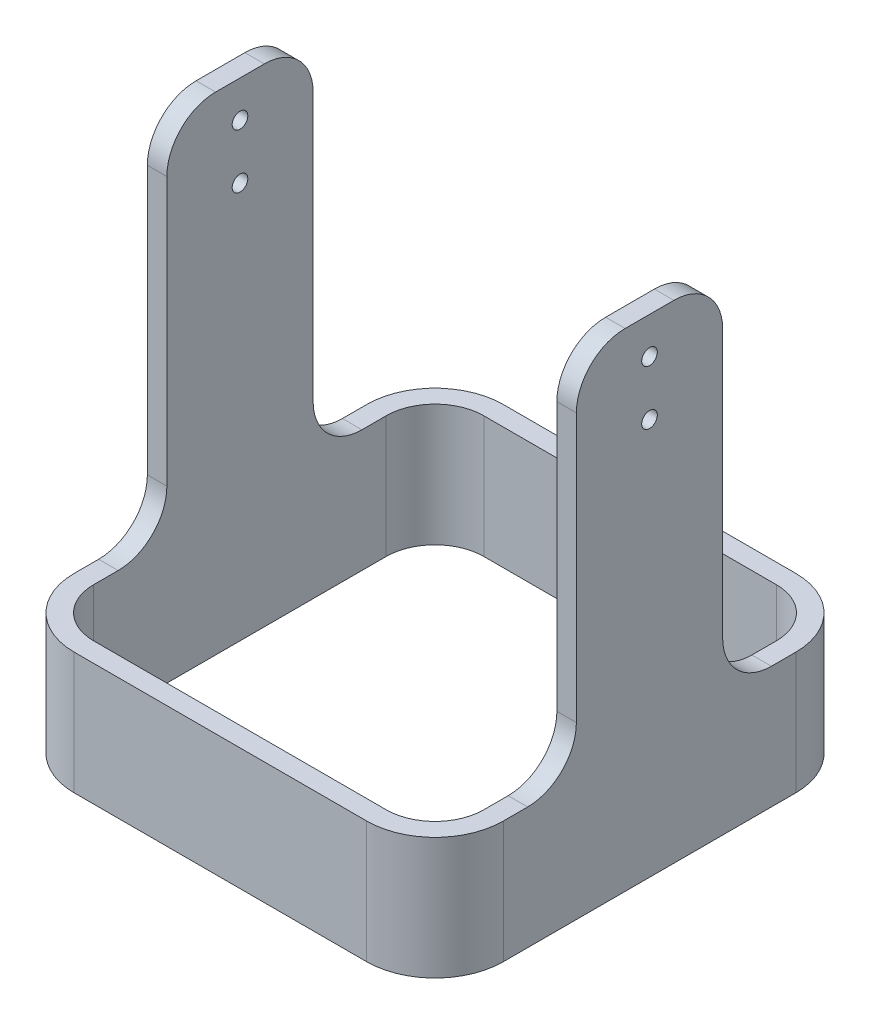
from build123d import *

# Parameters (mm, degrees)
ESQUISSE1_W             = 176
ESQUISSE1_H             = 176
ESQUISSE1_W_2           = 160
ESQUISSE1_H_2           = 160
BOSS_EXTRU_1_DEPTH      = 50
ESQUISSE2_W             = 8
ESQUISSE2_H             = 60
BOSS_EXTRU_2_DEPTH      = 150
ESQUISSE3_R             = 3.2
ENL_V_MAT_EXTRU_1_DEPTH = 281.570846668
CONG_1_R                = 20
CONG_2_R                = 28


with BuildPart() as part:
    # Esquisse1 → Boss.-Extru.1 (new body)
    with BuildSketch(Plane(origin=(0, 0, 0), x_dir=(1, 0, 0), z_dir=(0, 1, 0))):
        Rectangle(ESQUISSE1_W, ESQUISSE1_H)
        Rectangle(ESQUISSE1_W_2, ESQUISSE1_H_2, mode=Mode.SUBTRACT)
    extrude(amount=BOSS_EXTRU_1_DEPTH)

    # Esquisse2 → Boss.-Extru.2 (add)
    with BuildSketch(Plane(origin=(0, 50, 0), x_dir=(1, 0, 0), z_dir=(0, 1, 0))):
        with Locations((-84, 0)):
            Rectangle(ESQUISSE2_W, ESQUISSE2_H)
    boss_extru_2 = extrude(amount=BOSS_EXTRU_2_DEPTH)

    # Symétrie1: Boss.-Extru.2 across plane
    add(boss_extru_2.mirror(Plane(origin=(0, 0, 0), x_dir=(0, 0, 1), z_dir=(1, 0, 0))))

    # Esquisse3 → Enlèv. mat.-Extru.1 (cut, through all)
    with BuildSketch(Plane.ZY.offset(88)):
        with Locations((0, 185)):
            Circle(ESQUISSE3_R)
        with Locations((0, 162.65)):
            Circle(ESQUISSE3_R)
    extrude(amount=-ENL_V_MAT_EXTRU_1_DEPTH, mode=Mode.SUBTRACT)

    # Congé1
    cong_1_edges = [part.edges().sort_by_distance(p)[0] for p in [
        (-80, 25, 80),
        (80, 25, 80),
        (80, 25, -80),
        (-80, 25, -80),
        (84, 50, 30),
        (84, 50, -30),
        (-84, 50, -30),
        (-84, 50, 30),
        (84, 200, -30),
        (84, 200, 30),
        (-84, 200, -30),
        (-84, 200, 30),
    ]]
    fillet(cong_1_edges, radius=CONG_1_R)

    # Congé2
    cong_2_edges = [part.edges().sort_by_distance(p)[0] for p in [
        (88, 25, -88),
        (88, 25, 88),
        (-88, 25, -88),
        (-88, 25, 88),
    ]]
    fillet(cong_2_edges, radius=CONG_2_R)


solid = part.part
